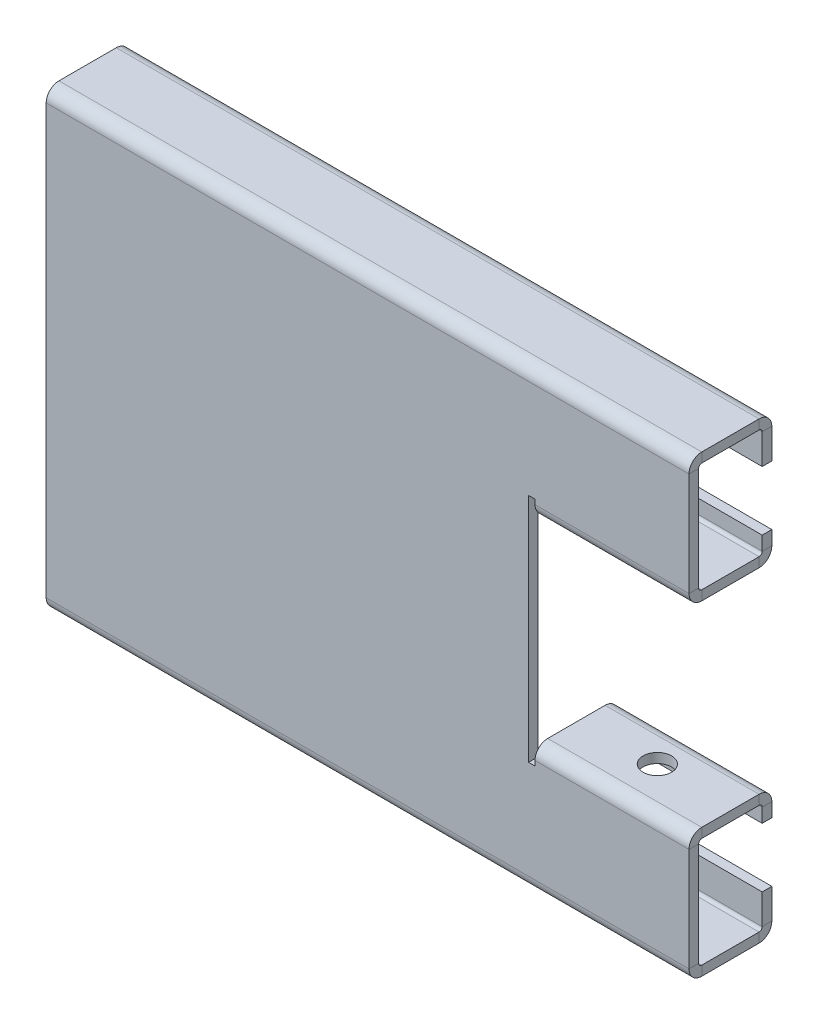
from build123d import *

# Parameters (mm, degrees)
SKETCH1_W                      = 152.4
SKETCH1_H                      = 101.6
BASE_FLANGE1_DEPTH             = 2.286
EDGE_FLANGE1_DEPTH             = 152.4
EDGE_FLANGE2_DEPTH             = 152.4
SKETCH14_W                     = 36.50996
SKETCH14_H                     = 46.482
CUT_EXTRUDE1_DEPTH             = 96.335271964
EDGE_FLANGE3_START             = 38.54704
EDGE_FLANGE3_DEPTH             = 37.65296
EDGE_FLANGE3_2_DEPTH           = 1.143
EDGE_FLANGE3_START_2           = 39.69004
EDGE_FLANGE3_3_DEPTH           = 36.50996
EDGE_FLANGE4_START             = 38.54704
EDGE_FLANGE4_DEPTH             = 37.65296
EDGE_FLANGE4_2_DEPTH           = 1.143
EDGE_FLANGE4_START_2           = 39.69004
EDGE_FLANGE4_3_DEPTH           = 36.50996
CUT_EXTRUDE3_REACH             = 112.14
SKETCH22_R                     = 3.3734375
CUT_EXTRUDE3_DIRECTION_2_REACH = 112.14
EDGE_FLANGE5_STRIP_W           = 10.6172
EDGE_FLANGE5_STRIP_H           = 2.286
EDGE_FLANGE5_STRIP_CUT_DEPTH   = 36.50996
EDGE_FLANGE5_DEPTH             = 36.50996
EDGE_FLANGE6_STRIP_W           = 10.6172
EDGE_FLANGE6_STRIP_H           = 2.286
EDGE_FLANGE6_STRIP_CUT_DEPTH   = 36.50996
EDGE_FLANGE6_DEPTH             = 36.50996
EDGE_FLANGE7_STRIP_W           = 10.6172
EDGE_FLANGE7_STRIP_H           = 2.286
EDGE_FLANGE7_STRIP_CUT_DEPTH   = 152.4
EDGE_FLANGE7_DEPTH             = 152.4
EDGE_FLANGE8_STRIP_W           = 10.6172
EDGE_FLANGE8_STRIP_H           = 2.286
EDGE_FLANGE8_STRIP_CUT_DEPTH   = 152.4
EDGE_FLANGE8_DEPTH             = 152.4
SKETCH35_W                     = 1.524
SKETCH35_H                     = 54.8132
CUT_EXTRUDE4_DEPTH             = 96.335271964


# Read off the part's stored shape, not the designer's step: Edge-Flange3, Edge-Flange4
# Sheet-metal steps are written as plain solids
with BuildPart() as part:
    # Sketch1 → Base-Flange1 (new body)
    with BuildSketch(Plane.XY):
        Rectangle(SKETCH1_W, SKETCH1_H)
    extrude(amount=-BASE_FLANGE1_DEPTH)

    # Edge-Flange1 section (across the edge) → Edge-Flange1 (add)
    with BuildSketch(Plane(origin=(-76.2, 51.5366, -2.286), x_dir=(0, -1, 0), z_dir=(1, 0, 0))):
        with BuildLine():
            Line((-2.286, 0.7366), (-2.286, 17.3482))
            Line((-2.286, 17.3482), (0, 17.3482))
            Line((0, 17.3482), (0, 0.7366))
            ThreePointArc((0, 0.7366), (0.215745145, 0.215745145), (0.7366, 0))
            Line((0.7366, 0), (0.7366, -2.286))
            ThreePointArc((0.7366, -2.286), (-1.400700957, -1.400700957), (-2.286, 0.7366))
        make_face()
    extrude(amount=EDGE_FLANGE1_DEPTH)

    # Edge-Flange2 section (across the edge) → Edge-Flange2 (add)
    with BuildSketch(Plane(origin=(76.2, -51.5366, -2.286), x_dir=(0, 1, 0), z_dir=(-1, 0, 0))):
        with BuildLine():
            Line((-2.286, 0.7366), (-2.286, 17.3482))
            Line((-2.286, 17.3482), (0, 17.3482))
            Line((0, 17.3482), (0, 0.7366))
            ThreePointArc((0, 0.7366), (0.215745145, 0.215745145), (0.7366, 0))
            Line((0.7366, 0), (0.7366, -2.286))
            ThreePointArc((0.7366, -2.286), (-1.400700957, -1.400700957), (-2.286, 0.7366))
        make_face()
    extrude(amount=EDGE_FLANGE2_DEPTH)

    # Sketch14 → Cut-Extrude1 (cut, through all)
    with BuildSketch(Plane.XY):
        with Locations((57.94502, 0)):
            Rectangle(SKETCH14_W, SKETCH14_H)
    extrude(amount=-CUT_EXTRUDE1_DEPTH, mode=Mode.SUBTRACT)

    # Edge-Flange3 outline → Edge-Flange3 (cut)
    with BuildSketch(Plane.YZ.offset(EDGE_FLANGE3_START)):
        with BuildLine():
            ThreePointArc((-26.2636, 0), (-24.404882216, -0.639056638), (-23.332127469, -2.286))
            Line((-23.332127469, -2.286), (-23.241, -2.286))
            Line((-23.241, -2.286), (-23.241, 0))
            Line((-23.241, 0), (-26.2636, 0))
        make_face()
    extrude(amount=EDGE_FLANGE3_DEPTH, mode=Mode.SUBTRACT)

    # Edge-Flange3 2 outline → Edge-Flange3 2 (cut)
    with BuildSketch(Plane.YZ.offset(EDGE_FLANGE3_START)):
        with BuildLine():
            Line((-27.4066, -2.286), (-23.332127469, -2.286))
            ThreePointArc((-23.332127469, -2.286), (-24.404882216, -0.639056638), (-26.2636, 0))
            Line((-26.2636, 0), (-27.4066, 0))
            Line((-27.4066, 0), (-27.4066, -2.286))
        make_face()
    extrude(amount=EDGE_FLANGE3_2_DEPTH, mode=Mode.SUBTRACT)

    # Edge-Flange3 3 outline → Edge-Flange3 3 (add)
    with BuildSketch(Plane.YZ.offset(EDGE_FLANGE3_START_2)):
        with BuildLine():
            Line((-25.527, -19.6342), (-23.241, -19.6342))
            Line((-23.241, -19.6342), (-23.241, -3.0226))
            ThreePointArc((-23.241, -3.0226), (-23.263868376, -2.651492275), (-23.332127469, -2.286))
            Line((-23.332127469, -2.286), (-26.2636, -2.286))
            ThreePointArc((-26.2636, -2.286), (-25.742745145, -2.501745145), (-25.527, -3.0226))
            Line((-25.527, -3.0226), (-25.527, -19.6342))
        make_face()
    extrude(amount=EDGE_FLANGE3_3_DEPTH)

    # Edge-Flange4 outline → Edge-Flange4 (cut)
    with BuildSketch(Plane.YZ.offset(EDGE_FLANGE4_START)):
        with BuildLine():
            Line((23.241, -2.286), (23.332127469, -2.286))
            ThreePointArc((23.332127469, -2.286), (24.404882216, -0.639056638), (26.2636, 0))
            Line((26.2636, 0), (23.241, 0))
            Line((23.241, 0), (23.241, -2.286))
        make_face()
    extrude(amount=EDGE_FLANGE4_DEPTH, mode=Mode.SUBTRACT)

    # Edge-Flange4 2 outline → Edge-Flange4 2 (cut)
    with BuildSketch(Plane.YZ.offset(EDGE_FLANGE4_START)):
        with BuildLine():
            Line((23.332127469, -2.286), (27.4066, -2.286))
            Line((27.4066, -2.286), (27.4066, 0))
            Line((27.4066, 0), (26.2636, 0))
            ThreePointArc((26.2636, 0), (24.404882216, -0.639056638), (23.332127469, -2.286))
        make_face()
    extrude(amount=EDGE_FLANGE4_2_DEPTH, mode=Mode.SUBTRACT)

    # Edge-Flange4 3 outline → Edge-Flange4 3 (add)
    with BuildSketch(Plane.YZ.offset(EDGE_FLANGE4_START_2)):
        with BuildLine():
            Line((23.241, -19.6342), (25.527, -19.6342))
            Line((25.527, -19.6342), (25.527, -3.0226))
            ThreePointArc((25.527, -3.0226), (25.742745145, -2.501745145), (26.2636, -2.286))
            Line((26.2636, -2.286), (23.332127469, -2.286))
            ThreePointArc((23.332127469, -2.286), (23.263868376, -2.651492275), (23.241, -3.0226))
            Line((23.241, -3.0226), (23.241, -19.6342))
        make_face()
    extrude(amount=EDGE_FLANGE4_3_DEPTH)

    # Cut-Extrude3: up to this face of the body (flat: up to its plane)
    cut_extrude3_end = Plane(part.part.faces().sort_by_distance((57.94502, -25.527, -11.3284))[0])
    # Sketch22 → Cut-Extrude3 (cut, up to the picked face)
    with BuildSketch(Plane(origin=(0, -23.241, 0), x_dir=(1, 0, 0), z_dir=(0, 1, 0)), mode=Mode.PRIVATE) as cut_extrude3_sk1:
        with Locations(Location((57.94502, 10.7442, 0), (0, 0, 270))):
            Circle(SKETCH22_R)
    cut_extrude3_tool1 = split(extrude(cut_extrude3_sk1.sketch, amount=-CUT_EXTRUDE3_REACH, mode=Mode.PRIVATE), bisect_by=cut_extrude3_end, keep=Keep.BOTH, mode=Mode.PRIVATE)
    add(cut_extrude3_tool1.solids().sort_by(Axis((57.94502, -23.241, -10.7442), (0, -1, 0)))[0], mode=Mode.SUBTRACT)

    # Cut-Extrude3 direction 2: up to this face of the body (flat: up to its plane)
    cut_extrude3_direction_2_end = Plane(part.part.faces().sort_by_distance((57.94502, 25.527, -11.3284))[0])
    # Sketch22 → Cut-Extrude3 direction 2 (cut, up to the picked face)
    with BuildSketch(Plane(origin=(0, -23.241, 0), x_dir=(1, 0, 0), z_dir=(0, 1, 0)), mode=Mode.PRIVATE) as cut_extrude3_direction_2_sk1:
        with Locations(Location((57.94502, 10.7442, 0), (0, 0, 270))):
            Circle(SKETCH22_R)
    cut_extrude3_direction_2_tool1 = split(extrude(cut_extrude3_direction_2_sk1.sketch, amount=CUT_EXTRUDE3_DIRECTION_2_REACH, mode=Mode.PRIVATE), bisect_by=cut_extrude3_direction_2_end, keep=Keep.BOTH, mode=Mode.PRIVATE)
    add(cut_extrude3_direction_2_tool1.solids().sort_by(Axis((57.94502, -23.241, -10.7442), (0, 1, 0)))[0], mode=Mode.SUBTRACT)

    # Edge-Flange5 strip (across the edge) → Edge-Flange5 strip cut (cut)
    with BuildSketch(Plane(origin=(39.69004, -25.527, -19.6342), x_dir=(0, 0, 1), z_dir=(1, 0, 0))):
        with Locations((-2.286, -1.143)):
            Rectangle(EDGE_FLANGE5_STRIP_W, EDGE_FLANGE5_STRIP_H)
    extrude(amount=EDGE_FLANGE5_STRIP_CUT_DEPTH, mode=Mode.SUBTRACT)

    # Edge-Flange5 section (across the edge) → Edge-Flange5 (add)
    with BuildSketch(Plane(origin=(39.69004, -25.527, -19.6342), x_dir=(0, 0, 1), z_dir=(1, 0, 0))):
        with BuildLine():
            Line((0, 0.7366), (0, 4.064))
            Line((0, 4.064), (2.286, 4.064))
            Line((2.286, 4.064), (2.286, 0.7366))
            ThreePointArc((2.286, 0.7366), (2.501745145, 0.215745145), (3.0226, 0))
            Line((3.0226, 0), (3.0226, -2.286))
            ThreePointArc((3.0226, -2.286), (0.885299043, -1.400700957), (0, 0.7366))
        make_face()
    extrude(amount=EDGE_FLANGE5_DEPTH)

    # Edge-Flange6 strip (across the edge) → Edge-Flange6 strip cut (cut)
    with BuildSketch(Plane(origin=(76.2, 25.527, -19.6342), x_dir=(0, 0, 1), z_dir=(-1, 0, 0))):
        with Locations((-2.286, -1.143)):
            Rectangle(EDGE_FLANGE6_STRIP_W, EDGE_FLANGE6_STRIP_H)
    extrude(amount=EDGE_FLANGE6_STRIP_CUT_DEPTH, mode=Mode.SUBTRACT)

    # Edge-Flange6 section (across the edge) → Edge-Flange6 (add)
    with BuildSketch(Plane(origin=(76.2, 25.527, -19.6342), x_dir=(0, 0, 1), z_dir=(-1, 0, 0))):
        with BuildLine():
            Line((0, 0.7366), (0, 4.064))
            Line((0, 4.064), (2.286, 4.064))
            Line((2.286, 4.064), (2.286, 0.7366))
            ThreePointArc((2.286, 0.7366), (2.501745145, 0.215745145), (3.0226, 0))
            Line((3.0226, 0), (3.0226, -2.286))
            ThreePointArc((3.0226, -2.286), (0.885299043, -1.400700957), (0, 0.7366))
        make_face()
    extrude(amount=EDGE_FLANGE6_DEPTH)

    # Edge-Flange7 strip (across the edge) → Edge-Flange7 strip cut (cut)
    with BuildSketch(Plane(origin=(76.2, -51.5366, -19.6342), x_dir=(0, 0, 1), z_dir=(-1, 0, 0))):
        with Locations((-2.286, -1.143)):
            Rectangle(EDGE_FLANGE7_STRIP_W, EDGE_FLANGE7_STRIP_H)
    extrude(amount=EDGE_FLANGE7_STRIP_CUT_DEPTH, mode=Mode.SUBTRACT)

    # Edge-Flange7 section (across the edge) → Edge-Flange7 (add)
    with BuildSketch(Plane(origin=(76.2, -51.5366, -19.6342), x_dir=(0, 0, 1), z_dir=(-1, 0, 0))):
        with BuildLine():
            Line((0, 0.7366), (0, 7.874))
            Line((0, 7.874), (2.286, 7.874))
            Line((2.286, 7.874), (2.286, 0.7366))
            ThreePointArc((2.286, 0.7366), (2.501745145, 0.215745145), (3.0226, 0))
            Line((3.0226, 0), (3.0226, -2.286))
            ThreePointArc((3.0226, -2.286), (0.885299043, -1.400700957), (0, 0.7366))
        make_face()
    extrude(amount=EDGE_FLANGE7_DEPTH)

    # Edge-Flange8 strip (across the edge) → Edge-Flange8 strip cut (cut)
    with BuildSketch(Plane(origin=(-76.2, 51.5366, -19.6342), x_dir=(0, 0, 1), z_dir=(1, 0, 0))):
        with Locations((-2.286, -1.143)):
            Rectangle(EDGE_FLANGE8_STRIP_W, EDGE_FLANGE8_STRIP_H)
    extrude(amount=EDGE_FLANGE8_STRIP_CUT_DEPTH, mode=Mode.SUBTRACT)

    # Edge-Flange8 section (across the edge) → Edge-Flange8 (add)
    with BuildSketch(Plane(origin=(-76.2, 51.5366, -19.6342), x_dir=(0, 0, 1), z_dir=(1, 0, 0))):
        with BuildLine():
            Line((0, 0.7366), (0, 7.874))
            Line((0, 7.874), (2.286, 7.874))
            Line((2.286, 7.874), (2.286, 0.7366))
            ThreePointArc((2.286, 0.7366), (2.501745145, 0.215745145), (3.0226, 0))
            Line((3.0226, 0), (3.0226, -2.286))
            ThreePointArc((3.0226, -2.286), (0.885299043, -1.400700957), (0, 0.7366))
        make_face()
    extrude(amount=EDGE_FLANGE8_DEPTH)

    # Sketch35 → Cut-Extrude4 (cut, through all)
    with BuildSketch(Plane.XY):
        with Locations((38.92804, 0)):
            Rectangle(SKETCH35_W, SKETCH35_H)
    extrude(amount=-CUT_EXTRUDE4_DEPTH, mode=Mode.SUBTRACT)


solid = part.part
